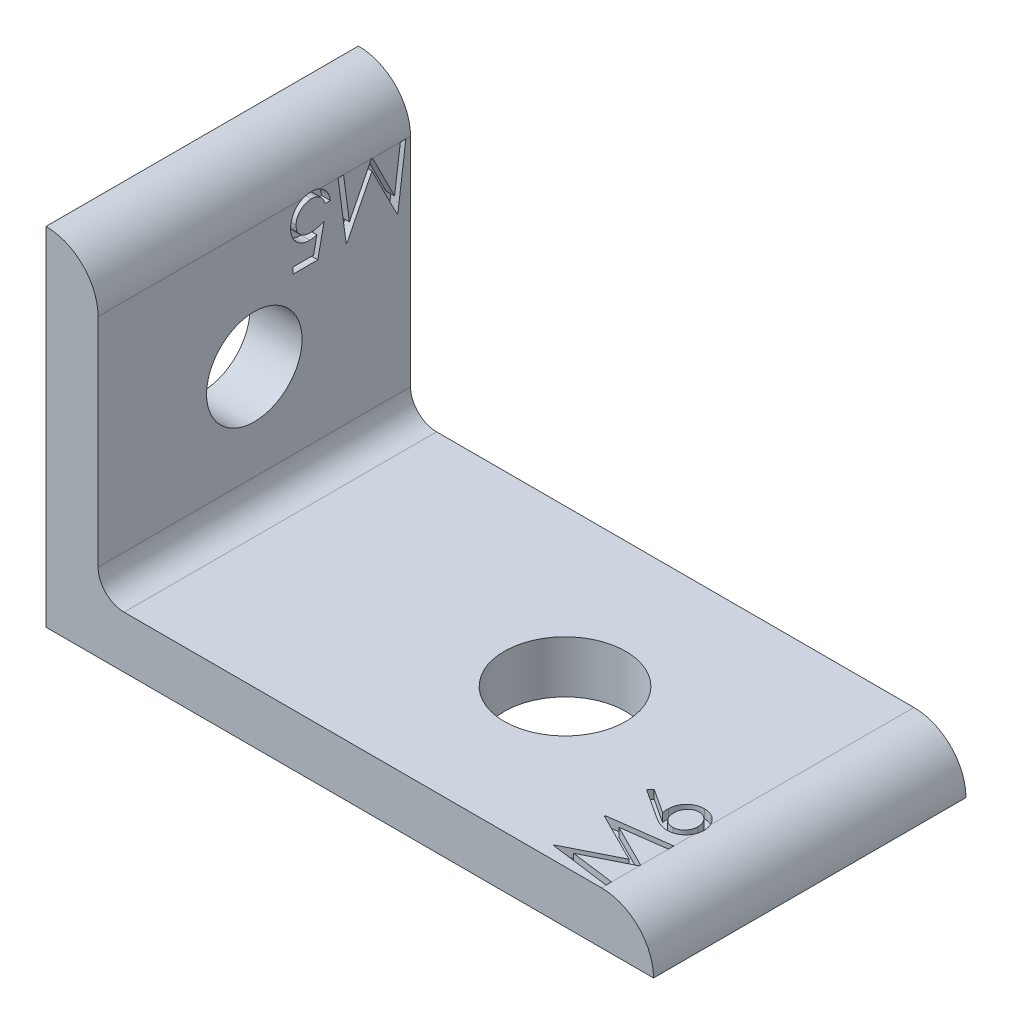
from build123d import *
from OCP.BRepFilletAPI import BRepFilletAPI_MakeFillet

# Parameters (mm, degrees)
BOSS_EXTRUDE1_DEPTH  = 18
FILLET1_R            = 3
FILLET1_R_2          = 1.5
M5_CLEARANCE_HOLE1_D = 5.5
CUT_EXTRUDE1_DEPTH   = 0.5
M6_CLEARANCE_HOLE1_D = 7
CUT_EXTRUDE2_DEPTH   = 0.5


with BuildPart() as part:
    # Sketch1 → Boss-Extrude1 (new body)
    with BuildSketch(Plane.XY):
        Polygon((0, 0), (0, 20), (3, 20), (3, 3), (35, 3), (35, 0), align=None)
    extrude(amount=-BOSS_EXTRUDE1_DEPTH)

    # Fillet1
    fillet1_edges_1 = [part.edges().sort_by_distance(p)[0] for p in [
        (3, 20, -9),
        (35, 3, -9),
    ]]
    fillet1_edges_2 = [part.edges().sort_by_distance(p)[0] for p in [
        (3, 3, -9),
    ]]
    fillet1 = BRepFilletAPI_MakeFillet(part.part.solid().wrapped)
    for e in fillet1_edges_1:
        fillet1.Add(FILLET1_R - 0.0001, e.wrapped)
    for e in fillet1_edges_2:
        fillet1.Add(FILLET1_R_2 - 0.0001, e.wrapped)
    add(Compound.cast(fillet1.Shape()), mode=Mode.REPLACE)  # a hair under: the kernel refuses the full size

    # M5 Clearance Hole1 (through all)
    with Locations(Plane(origin=(3, 0, 0), x_dir=(0, 0, -1), z_dir=(1, 0, 0))):
        with Locations((9, 10)):
            Hole(M5_CLEARANCE_HOLE1_D / 2)

    # Sketch6 → Cut-Extrude1 (cut)
    with BuildSketch(Plane(origin=(3, 0, 0), x_dir=(0, 0, -1), z_dir=(1, 0, 0))):
        Polygon((17.730769231, 17), (17.268729968, 13.5), (17.223858173, 13.5), (15.778846154, 16.371794872), (14.337339744, 13.5), (14.291766827, 13.5), (13.826923077, 17), (14.142427885, 17), (14.477564103, 14.481570513), (15.740985577, 17), (15.811798878, 17), (17.080128205, 14.475961538), (17.414563301, 17), align=None)
        with BuildLine():
            Line((11.224358974, 13.5), (11.224358974, 13.858974359))
            Line((11.224358974, 13.858974359), (12.414863782, 13.858974359))
            Line((12.414863782, 13.858974359), (12.603465545, 14.779547276))
            add(Edge.make_bspline(
                [(12.603465545, 14.779547276), (12.56640967, 14.769317004), (12.494619775, 14.74949747), (12.388659914, 14.7274917), (12.28806771, 14.714226256), (12.22279234, 14.712414945), (12.191205929, 14.711538462)],
                knots=[0, 0, 0, 0, 1.100273476, 2.13160584, 3.095893838, 4, 4, 4, 4], degree=3))
            add(Edge.make_bspline(
                [(12.191205929, 14.711538462), (12.152115151, 14.712356682), (12.075252912, 14.713965508), (11.962966689, 14.730323521), (11.855246315, 14.754032771), (11.753641203, 14.790502123), (11.656513271, 14.835324732), (11.565179332, 14.891047043), (11.47921036, 14.956875042), (11.398794267, 15.03145835), (11.326296336, 15.114498692), (11.263045784, 15.203857518), (11.208981729, 15.298537716), (11.165854625, 15.399410181), (11.130887974, 15.505524302), (11.107767984, 15.617770488), (11.092342425, 15.735214846), (11.090621268, 15.815519939), (11.08974359, 15.856470353)],
                knots=[0, 0, 0, 0, 1.052656913, 2.069786496, 3.052102726, 4.020122636, 4.972424848, 5.930457368, 6.896570172, 7.885826804, 8.881139003, 9.861434336, 10.831623367, 11.813212553, 12.812997731, 13.836986694, 14.897002833, 16, 16, 16, 16], degree=3))
            add(Edge.make_bspline(
                [(11.08974359, 15.856470353), (11.090409175, 15.884992432), (11.091731349, 15.94165114), (11.098442467, 16.025797405), (11.111405972, 16.108152559), (11.128624074, 16.188553478), (11.151519294, 16.267120147), (11.178594028, 16.344037937), (11.211000658, 16.419179598), (11.247981059, 16.492171231), (11.290055056, 16.561576176), (11.334957466, 16.628203149), (11.383885509, 16.690119233), (11.435982665, 16.748359367), (11.49224925, 16.801248461), (11.551304477, 16.850992808), (11.614468939, 16.89548242), (11.680629097, 16.936400096), (11.74973854, 16.973036914), (11.822499292, 17.003598379), (11.897313723, 17.030385819), (11.974848741, 17.052169495), (12.054954109, 17.069070481), (12.137905685, 17.080579823), (12.22328723, 17.088953871), (12.281162123, 17.089478555), (12.310396635, 17.08974359)],
                knots=[0, 0, 0, 0, 1.056281413, 2.098288097, 3.122646807, 4.141030392, 5.140675379, 6.150604744, 7.15845591, 8.168533554, 9.177684096, 10.161739049, 11.141561652, 12.097360316, 13.052218386, 13.998410789, 14.954052752, 15.909851415, 16.877523809, 17.846742625, 18.829312613, 19.818263486, 20.826374662, 21.858017533, 22.918014209, 24, 24, 24, 24], degree=3))
            add(Edge.make_bspline(
                [(12.310396635, 17.08974359), (12.345269883, 17.089050833), (12.413878878, 17.087687916), (12.514412741, 17.073496783), (12.611078794, 17.053032979), (12.703476119, 17.022731017), (12.791170198, 16.982994874), (12.87543312, 16.936086027), (12.954722456, 16.879468906), (13.029600723, 16.815173211), (13.098288895, 16.743861225), (13.161524096, 16.668045854), (13.216277857, 16.586045539), (13.263853476, 16.499228306), (13.304324948, 16.407367825), (13.33614726, 16.310250878), (13.361823608, 16.208349215), (13.372687305, 16.138195934), (13.378205128, 16.102564103)],
                knots=[0, 0, 0, 0, 1.04695683, 2.059763882, 3.044413726, 4.012427942, 4.974081556, 5.932886124, 6.904940154, 7.895678616, 8.893654631, 9.876199664, 10.857615262, 11.850515636, 12.847107701, 13.868396357, 14.917328757, 16, 16, 16, 16], degree=3))
            Line((13.378205128, 16.102564103), (13.064102564, 16.102564103))
            add(Edge.make_bspline(
                [(13.064102564, 16.102564103), (13.05638371, 16.135947253), (13.041547644, 16.200111523), (13.008812765, 16.290153724), (12.969421893, 16.370725894), (12.920410206, 16.441321336), (12.86473818, 16.504316302), (12.80048365, 16.560336025), (12.728192646, 16.610266101), (12.647849023, 16.652225353), (12.562870323, 16.687518155), (12.47445006, 16.712716834), (12.383843767, 16.727967174), (12.322841247, 16.729831697), (12.292167468, 16.730769231)],
                knots=[0, 0, 0, 0, 1.136370375, 2.184166959, 3.172867797, 4.104539607, 5.027679118, 5.956634301, 6.927059835, 7.936867459, 8.959641981, 9.976160943, 10.98235693, 12, 12, 12, 12], degree=3))
            add(Edge.make_bspline(
                [(12.292167468, 16.730769231), (12.262211565, 16.729941585), (12.203228147, 16.728311945), (12.116380308, 16.715971436), (12.032777054, 16.696466408), (11.952269978, 16.66914098), (11.875254676, 16.632991042), (11.80184004, 16.588582926), (11.730980213, 16.537024575), (11.66454012, 16.478095262), (11.603703878, 16.413118241), (11.549946919, 16.343642762), (11.505170225, 16.269525414), (11.467436058, 16.192052394), (11.438782775, 16.110373801), (11.418341789, 16.024872636), (11.406338732, 15.935337653), (11.404687552, 15.874268343), (11.403846154, 15.843149038)],
                knots=[0, 0, 0, 0, 1.027268864, 2.022700798, 3.002744649, 3.968653148, 4.933396556, 5.915045722, 6.907600446, 7.935526002, 8.956456544, 9.95700807, 10.942805781, 11.92166854, 12.907987664, 13.905483474, 14.932689774, 16, 16, 16, 16], degree=3))
            add(Edge.make_bspline(
                [(11.403846154, 15.843149038), (11.404377978, 15.81505294), (11.405415159, 15.760258951), (11.417681163, 15.680167952), (11.434202505, 15.603716679), (11.460259635, 15.531619445), (11.491909703, 15.463123557), (11.533148431, 15.399921468), (11.578740523, 15.338922848), (11.633340165, 15.284160422), (11.692458997, 15.233194886), (11.757973336, 15.189968945), (11.828010917, 15.153191718), (11.90273496, 15.123063783), (11.982228415, 15.099063355), (12.06653662, 15.082476642), (12.15567808, 15.072551324), (12.216653729, 15.071204912), (12.247996795, 15.070512821)],
                knots=[0, 0, 0, 0, 1.045820996, 2.039596555, 3.013371638, 3.9552447, 4.890047302, 5.817684688, 6.761648481, 7.722253242, 8.692244539, 9.66551337, 10.63924952, 11.635311376, 12.662847378, 13.728455105, 14.832366986, 16, 16, 16, 16], degree=3))
            add(Edge.make_bspline(
                [(12.247996795, 15.070512821), (12.275361318, 15.071073696), (12.331380744, 15.072221896), (12.417510517, 15.081257989), (12.507626117, 15.095159149), (12.602077402, 15.115195157), (12.700605167, 15.140281619), (12.803373264, 15.171611464), (12.910384177, 15.207699495), (12.982410184, 15.235690601), (13.019230769, 15.25)],
                knots=[0, 0, 0, 0, 0.824638674, 1.688163388, 2.607705698, 3.571998603, 4.597075385, 5.671199175, 6.809488238, 8, 8, 8, 8], degree=3))
            Line((13.019230769, 15.25), (12.66025641, 13.5))
            Line((12.66025641, 13.5), (11.224358974, 13.5))
        make_face()
    extrude(amount=-CUT_EXTRUDE1_DEPTH, mode=Mode.SUBTRACT)

    # M6 Clearance Hole1 (through all)
    with Locations(Plane(origin=(0, 3, 0), x_dir=(1, 0, 0), z_dir=(0, 1, 0))):
        with Locations((20.9, 9)):
            Hole(M6_CLEARANCE_HOLE1_D / 2)

    # Sketch10 → Cut-Extrude2 (cut)
    # profile 1 of 2: a face of its own
    with BuildSketch(Plane(origin=(0, 3, 0), x_dir=(1, 0, 0), z_dir=(0, 1, 0))):
        Polygon((32, 0.269230769), (28.5, 0.731270032), (28.5, 0.776141827), (31.371794872, 2.221153846), (28.5, 3.662660256), (28.5, 3.708233173), (32, 4.173076923), (32, 3.857572115), (29.481570513, 3.522435897), (32, 2.259014423), (32, 2.188201122), (29.475961538, 0.919871795), (32, 0.585436699), align=None)
    # profile 2 of 2: a face of its own
    with BuildSketch(Plane(origin=(0, 3, 0), x_dir=(1, 0, 0), z_dir=(0, 1, 0))):
        with BuildLine():
            Line((28.41025641, 6.192307692), (28.600260417, 6.434194712))
            Line((28.600260417, 6.434194712), (30.014423077, 5.509415064))
            add(Edge.make_bspline(
                [(30.014423077, 5.509415064), (30.004609216, 5.570985341), (29.985466171, 5.691085128), (29.982308226, 5.812651026), (29.980769231, 5.871895032)],
                knots=[0, 0, 0, 0, 1.025318673, 2, 2, 2, 2], degree=3))
            add(Edge.make_bspline(
                [(29.980769231, 5.871895032), (29.981725342, 5.907467528), (29.98360742, 5.977490929), (29.998091271, 6.08029773), (30.020916381, 6.17908667), (30.054188643, 6.273448268), (30.096690975, 6.363721302), (30.147629933, 6.450423501), (30.209635277, 6.531926268), (30.278901527, 6.60927453), (30.355613695, 6.679512484), (30.43703245, 6.741649277), (30.523151353, 6.79412899), (30.613951036, 6.835939869), (30.708720734, 6.869354166), (30.807830055, 6.893141078), (30.911446272, 6.907361252), (30.981926547, 6.909281157), (31.017728365, 6.91025641)],
                knots=[0, 0, 0, 0, 1.043709831, 2.054511743, 3.041122595, 4.01515914, 4.98481438, 5.965901842, 6.960491961, 7.985277438, 9.0096037, 10.00832444, 10.987059228, 11.962929573, 12.936966118, 13.931840027, 14.949438142, 16, 16, 16, 16], degree=3))
            add(Edge.make_bspline(
                [(31.017728365, 6.91025641), (31.066709902, 6.908836764), (31.163093975, 6.906043236), (31.303444496, 6.878090034), (31.437073838, 6.834977722), (31.561669725, 6.772369255), (31.678095119, 6.696076456), (31.780915813, 6.601895389), (31.872615482, 6.494498796), (31.949263851, 6.37299894), (32.011869141, 6.24225952), (32.056833789, 6.104906582), (32.084517414, 5.962279683), (32.087987996, 5.865475041), (32.08974359, 5.81650641)],
                knots=[0, 0, 0, 0, 1.031403119, 2.029557249, 3.004870281, 3.983165322, 4.960181699, 5.929903783, 6.912123683, 7.928973898, 8.949315281, 9.960468141, 10.968302741, 12, 12, 12, 12], degree=3))
            add(Edge.make_bspline(
                [(32.08974359, 5.81650641), (32.088219727, 5.769407727), (32.085201221, 5.676113483), (32.058171766, 5.538909681), (32.014673233, 5.406840091), (31.953489652, 5.281600011), (31.877512446, 5.165391436), (31.786683496, 5.060594667), (31.680876618, 4.970018339), (31.562406401, 4.893961485), (31.435279432, 4.833382218), (31.30249364, 4.788377413), (31.164606489, 4.761950416), (31.071123619, 4.758266008), (31.024038462, 4.756410256)],
                knots=[0, 0, 0, 0, 1.012172929, 2.004937354, 2.995255351, 3.995689452, 4.993936421, 5.973737378, 6.968231049, 7.979117505, 8.993136101, 9.989812463, 10.987515067, 12, 12, 12, 12], degree=3))
            add(Edge.make_bspline(
                [(31.024038462, 4.756410256), (30.987993878, 4.757591701), (30.914397726, 4.760003986), (30.802933698, 4.776847377), (30.688882617, 4.803912172), (30.592128423, 4.834222418), (30.512866901, 4.866248028), (30.44896341, 4.892900567), (30.383202337, 4.926074564), (30.313328701, 4.961447945), (30.241143269, 5.002204814), (30.165439599, 5.046520463), (30.087421671, 5.095620114), (30.034477476, 5.130040277), (30.007411859, 5.147636218)],
                knots=[0, 0, 0, 0, 1.173818275, 2.396712641, 3.66331629, 4.989737886, 5.693666774, 6.447286557, 7.243889047, 8.091586357, 8.998013824, 9.943181721, 10.948533338, 12, 12, 12, 12], degree=3))
            Line((30.007411859, 5.147636218), (28.41025641, 6.192307692))
        make_face()
        with BuildLine():
            add(Edge.make_bspline(
                [(30.33974359, 5.805989583), (30.340514122, 5.779324741), (30.342019195, 5.727240558), (30.350949514, 5.650869476), (30.367203713, 5.578354721), (30.389741576, 5.509675245), (30.417528124, 5.444407366), (30.453180704, 5.383844512), (30.494707823, 5.326740437), (30.542034356, 5.274007515), (30.593815605, 5.226185037), (30.649286894, 5.185004639), (30.707100639, 5.149482049), (30.767742702, 5.12060028), (30.831189169, 5.098110191), (30.897148427, 5.081841944), (30.966062731, 5.072788192), (31.012795234, 5.07128196), (31.036658654, 5.070512821)],
                knots=[0, 0, 0, 0, 1.129656352, 2.206547016, 3.251334079, 4.271920891, 5.265058649, 6.249872215, 7.241923875, 8.251504132, 9.246416584, 10.222533834, 11.173322129, 12.116503788, 13.062124155, 14.020151864, 14.989013135, 16, 16, 16, 16], degree=3))
            add(Edge.make_bspline(
                [(31.036658654, 5.070512821), (31.060304502, 5.071161363), (31.106901546, 5.072439395), (31.175301248, 5.083320553), (31.240973414, 5.100712948), (31.303671235, 5.125837436), (31.364598346, 5.156368693), (31.421852824, 5.195557912), (31.477289265, 5.24053575), (31.528331908, 5.293051484), (31.575717816, 5.349841781), (31.617307799, 5.410388291), (31.652476442, 5.473779387), (31.681617549, 5.539832495), (31.70306956, 5.609364118), (31.719492241, 5.681245236), (31.728470744, 5.756453159), (31.729993013, 5.807370259), (31.730769231, 5.833333333)],
                knots=[0, 0, 0, 0, 0.989367052, 1.949669134, 2.891858276, 3.827522767, 4.772653562, 5.738670152, 6.725809442, 7.756636004, 8.798867547, 9.819240912, 10.826537776, 11.829883227, 12.835515726, 13.868058748, 14.912904531, 16, 16, 16, 16], degree=3))
            add(Edge.make_bspline(
                [(31.730769231, 5.833333333), (31.729992952, 5.859296365), (31.728470565, 5.910213382), (31.719492921, 5.985421909), (31.703067067, 6.057300792), (31.681626581, 6.126840536), (31.65244273, 6.192863525), (31.617527885, 6.256199209), (31.575462809, 6.316173082), (31.528413268, 6.373000337), (31.476997598, 6.425297824), (31.422352334, 6.471333492), (31.364140222, 6.509298355), (31.303910799, 6.541040155), (31.240935965, 6.565886452), (31.175311469, 6.583364473), (31.106898879, 6.594222482), (31.060303604, 6.595503692), (31.036658654, 6.596153846)],
                knots=[0, 0, 0, 0, 1.087281468, 2.132306021, 3.165025708, 4.170830268, 5.174347389, 6.181816599, 7.194310624, 8.23672049, 9.267723423, 10.261267456, 11.222032883, 12.171822355, 13.107646935, 14.049997283, 15.01046367, 16, 16, 16, 16], degree=3))
            add(Edge.make_bspline(
                [(31.036658654, 6.596153846), (31.012764103, 6.595603553), (30.96586687, 6.594523507), (30.897179254, 6.582307558), (30.830854039, 6.565365187), (30.767308122, 6.539782144), (30.706792075, 6.506545646), (30.649000936, 6.466062057), (30.593488777, 6.419230201), (30.541933027, 6.36512988), (30.494759132, 6.306250215), (30.453237816, 6.24359591), (30.417795052, 6.178309427), (30.389827904, 6.109471113), (30.367297253, 6.03800718), (30.351007467, 5.963424159), (30.342042474, 5.885669007), (30.340519645, 5.832887686), (30.33974359, 5.805989583)],
                knots=[0, 0, 0, 0, 0.978259475, 1.920005202, 2.851759169, 3.7803069, 4.719124913, 5.675758531, 6.668034766, 7.691045932, 8.733780038, 9.756656648, 10.768121246, 11.773215211, 12.79725739, 13.836288844, 14.897342417, 16, 16, 16, 16], degree=3))
        make_face(mode=Mode.SUBTRACT)
    extrude(amount=-CUT_EXTRUDE2_DEPTH, mode=Mode.SUBTRACT)


solid = part.part
